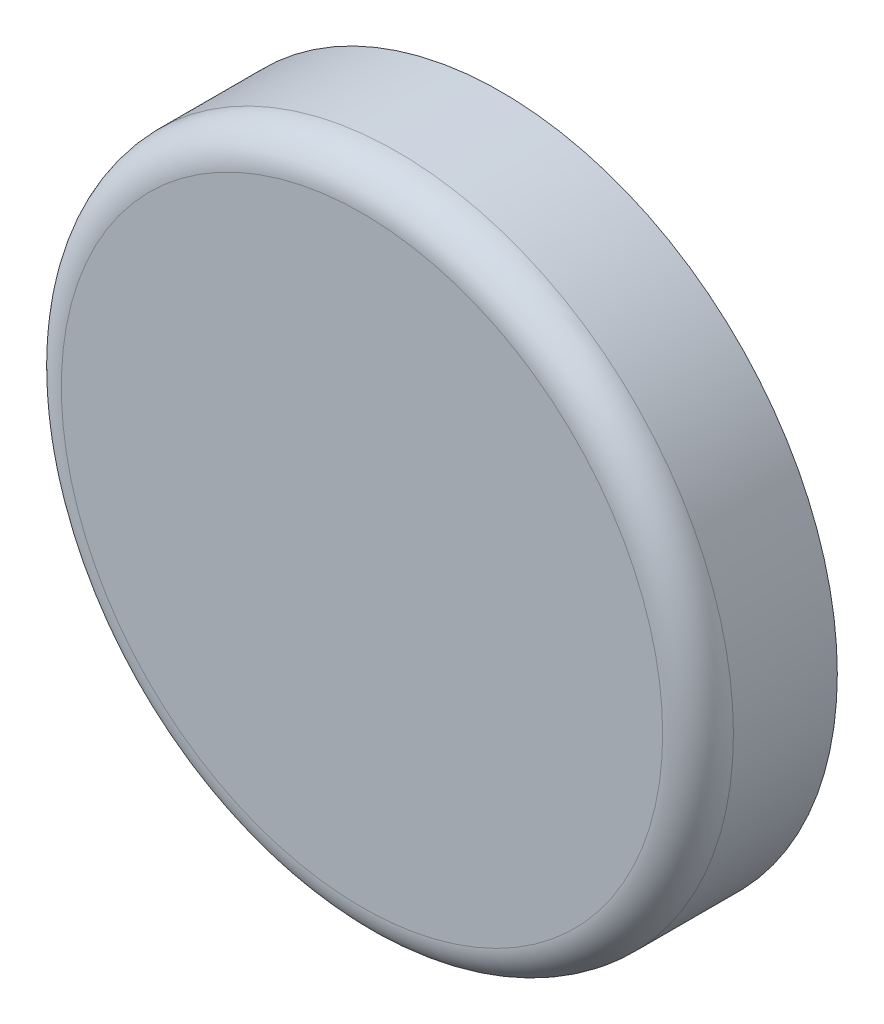
from build123d import *

# Parameters (mm, degrees)
SKETCH1_R           = 12.065
BOSS_EXTRUDE1_DEPTH = 5
FILLET1_R           = 1.27
SKETCH2_W           = 1.016
SKETCH2_H           = 4.168
SKETCH2_W_2         = 4.168
SKETCH2_H_2         = 1.016
BOSS_EXTRUDE2_DEPTH = 1.524


with BuildPart() as part:
    # Sketch1 → Boss-Extrude1 (new body)
    with BuildSketch(Plane.XY):
        Circle(SKETCH1_R)
    extrude(amount=BOSS_EXTRUDE1_DEPTH)

    # Fillet1
    fillet1_edges = [part.edges().sort_by_distance(p)[0] for p in [
        (-12.065, 0, 5),
    ]]
    fillet(fillet1_edges, radius=FILLET1_R)

    # Sketch2 → Boss-Extrude2 (add)
    with BuildSketch(Plane(origin=(0, 0, 0), x_dir=(-1, 0, 0), z_dir=(0, 0, -1))):
        with Locations((3.608, 0)):
            Rectangle(SKETCH2_W, SKETCH2_H)
        with Locations((0, 3.608)):
            Rectangle(SKETCH2_W_2, SKETCH2_H_2)
        with Locations((0, -3.608)):
            Rectangle(SKETCH2_W_2, SKETCH2_H_2)
        with Locations((-3.608, 0)):
            Rectangle(SKETCH2_W, SKETCH2_H)
    extrude(amount=BOSS_EXTRUDE2_DEPTH)


solid = part.part
